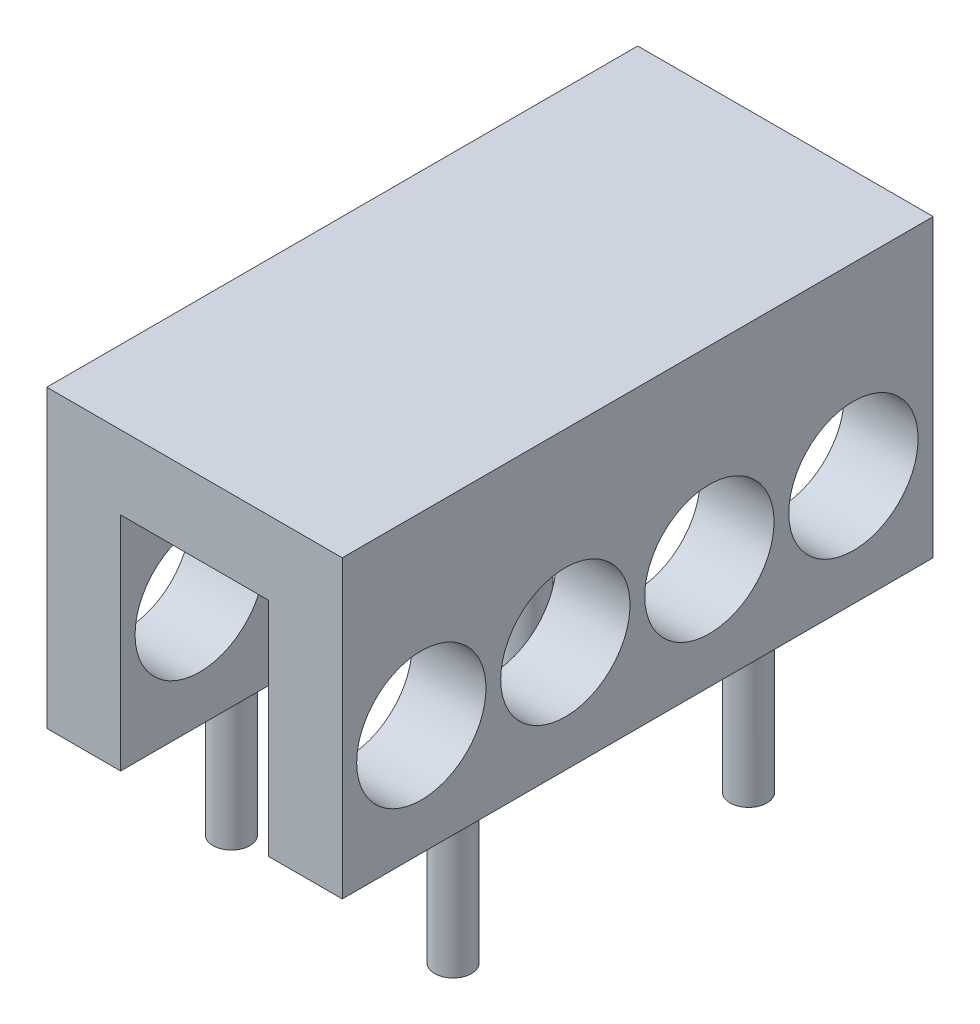
from build123d import *

# Parameters (mm, degrees)
BOSS_EXTRUDE1_DEPTH = 101.6
SKETCH5_R           = 11.1125
CUT_EXTRUDE1_DEPTH  = 125.434078933
SKETCH6_R           = 3.175
BOSS_EXTRUDE3_DEPTH = 25.4


with BuildPart() as part:
    # Sketch4 → Boss-Extrude1 (new body)
    with BuildSketch(Plane.XY):
        Polygon((0, 0), (0, 50.8), (50.8, 50.8), (50.8, 0), (38.1, 0), (38.1, 38.135977337), (12.7, 38.135977337), (12.7, 0), align=None)
    extrude(amount=BOSS_EXTRUDE1_DEPTH)

    # Sketch5 → Cut-Extrude1 (cut, through all)
    with BuildSketch(Plane.ZY):
        with Locations((13.716, 19.05)):
            Circle(SKETCH5_R)
        with Locations((38.481, 19.05)):
            Circle(SKETCH5_R)
        with Locations((63.246, 19.05)):
            Circle(SKETCH5_R)
        with Locations((88.011, 19.05)):
            Circle(SKETCH5_R)
    extrude(amount=-CUT_EXTRUDE1_DEPTH, mode=Mode.SUBTRACT)

    # Sketch6 → Boss-Extrude3 (add)
    with BuildSketch(Plane.XZ):
        with Locations((6.35, 25.4)):
            Circle(SKETCH6_R)
        with Locations((6.35, 76.2)):
            Circle(SKETCH6_R)
        with Locations((44.45, 76.2)):
            Circle(SKETCH6_R)
        with Locations((44.45, 25.4)):
            Circle(SKETCH6_R)
    extrude(amount=BOSS_EXTRUDE3_DEPTH)


solid = part.part
